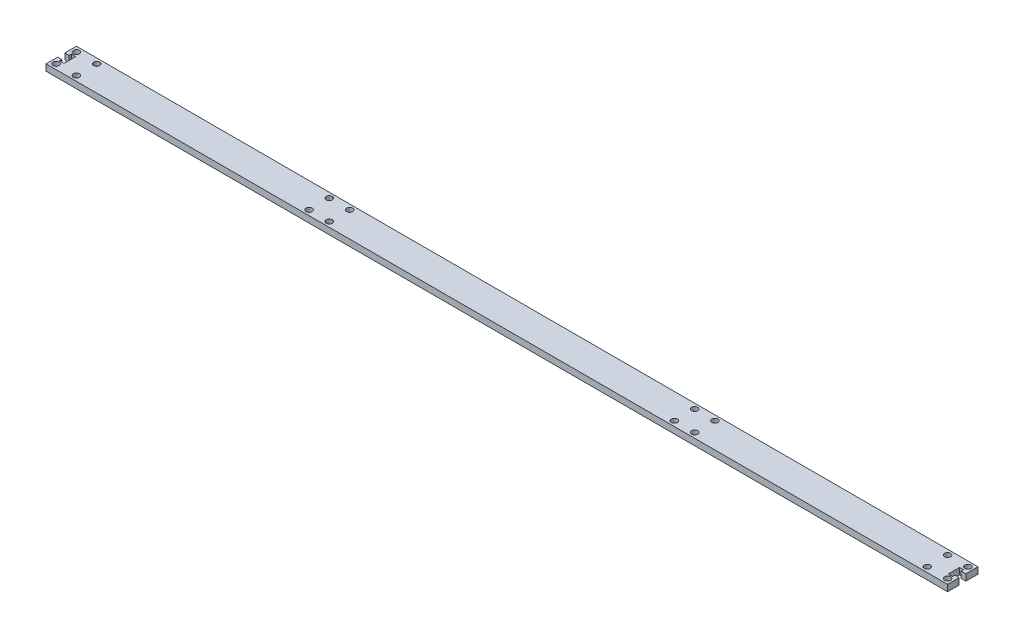
from build123d import *

# Parameters (mm, degrees)
SKETCH1_R           = 1.5
BOSS_EXTRUDE1_DEPTH = 3.175
CUT_EXTRUDE2_DEPTH  = 10
SKETCH6_W           = 2.65
SKETCH6_H           = 3.175
CUT_EXTRUDE3_DEPTH  = 0.25


with BuildPart() as part:
    # Sketch1 → Boss-Extrude1 (new body)
    with BuildSketch(Plane(origin=(0, 0, 0), x_dir=(1, 0, 0), z_dir=(0, 1, 0))):
        Polygon((0, 7.5), (0, 0), (444.5, 0), (444.5, 15), (0, 15), align=None)
        with Locations((2.5, 2.5)):
            Circle(SKETCH1_R, mode=Mode.SUBTRACT)
        with Locations((12.5, 2.5)):
            Circle(SKETCH1_R, mode=Mode.SUBTRACT)
        with Locations((2.5, 12.5)):
            Circle(SKETCH1_R, mode=Mode.SUBTRACT)
        with Locations((12.5, 12.5)):
            Circle(SKETCH1_R, mode=Mode.SUBTRACT)
        with Locations((127.2, 2.5)):
            Circle(SKETCH1_R, mode=Mode.SUBTRACT)
        with Locations((137.2, 2.5)):
            Circle(SKETCH1_R, mode=Mode.SUBTRACT)
        with Locations((127.2, 12.5)):
            Circle(SKETCH1_R, mode=Mode.SUBTRACT)
        with Locations((137.2, 12.5)):
            Circle(SKETCH1_R, mode=Mode.SUBTRACT)
        with Locations((442, 12.5)):
            Circle(SKETCH1_R, mode=Mode.SUBTRACT)
        with Locations((307.3, 2.5)):
            Circle(SKETCH1_R, mode=Mode.SUBTRACT)
        with Locations((317.3, 2.5)):
            Circle(SKETCH1_R, mode=Mode.SUBTRACT)
        with Locations((432, 2.5)):
            Circle(SKETCH1_R, mode=Mode.SUBTRACT)
        with Locations((442, 2.5)):
            Circle(SKETCH1_R, mode=Mode.SUBTRACT)
        with Locations((307.3, 12.5)):
            Circle(SKETCH1_R, mode=Mode.SUBTRACT)
        with Locations((317.3, 12.5)):
            Circle(SKETCH1_R, mode=Mode.SUBTRACT)
        with Locations((432, 12.5)):
            Circle(SKETCH1_R, mode=Mode.SUBTRACT)
    extrude(amount=BOSS_EXTRUDE1_DEPTH)

    # Sketch4 → Cut-Extrude2 (cut)
    with BuildSketch(Plane(origin=(0, 3.175, 0), x_dir=(1, 0, 0), z_dir=(0, 1, 0))):
        Polygon((444.5, 5.75), (444.5, 9), (442.2, 9), (442.2, 10.15), (440.5, 10.15), (440.5, 7.5), (440.25, 7.5), (440.25, 4.6), (442.45, 4.6), (442.45, 5.75), align=None)
        Polygon((2.05, 9.25), (0, 9.25), (0, 5.75), (2.05, 5.75), (2.05, 4.6), (4.25, 4.6), (4.25, 10.4), (2.05, 10.4), align=None)
    extrude(amount=-CUT_EXTRUDE2_DEPTH, mode=Mode.SUBTRACT)

    # Sketch6 → Cut-Extrude3 (cut)
    with BuildSketch(Plane(origin=(440.5, 0, 0), x_dir=(0, 0, -1), z_dir=(1, 0, 0))):
        with Locations((8.825, 1.5875)):
            Rectangle(SKETCH6_W, SKETCH6_H)
    extrude(amount=-CUT_EXTRUDE3_DEPTH, mode=Mode.SUBTRACT)


solid = part.part
